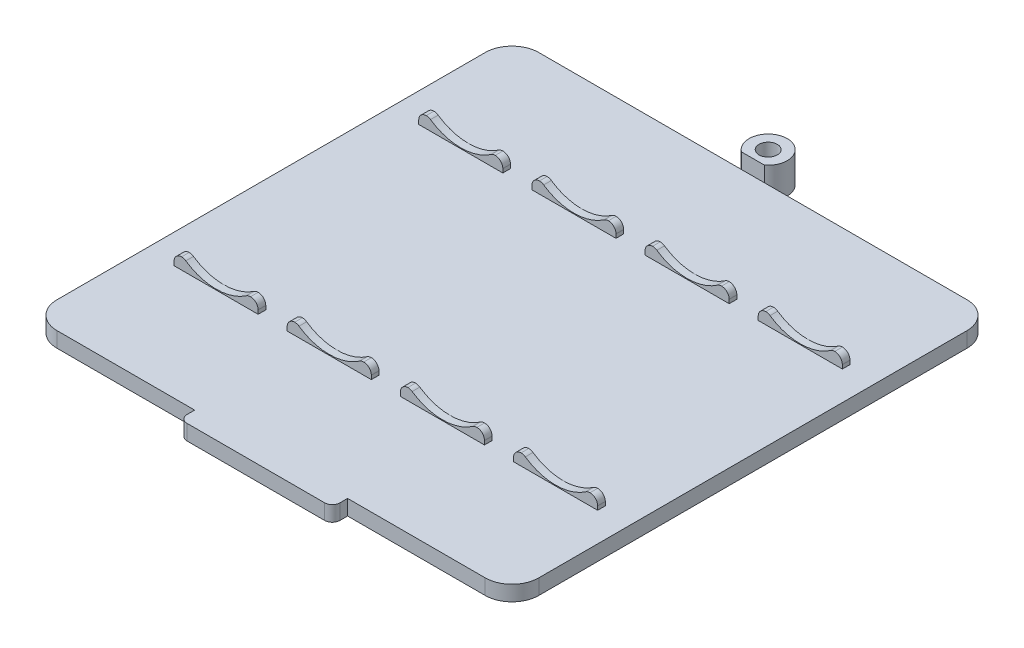
from build123d import *

# Parameters (mm, degrees)
BOSS_EXTRUDE1_DEPTH                     = 2
SKETCH2_R                               = 2.5
BOSS_EXTRUDE3_DEPTH                     = 4
SKETCH5_W                               = 11
SKETCH5_H                               = 1
EXTRUDE_THIN2_DEPTH                     = 1.5
CUT_EXTRUDE2_DEPTH                      = 49.002604096
CUT_EXTRUDE2_DEPTH_BACK                 = 49.002604096
SKETCH7_R                               = 7
FILLET2_R                               = 1
CUT_EXTRUDE3_START                      = -2
CUT_EXTRUDE3_DEPTH                      = 2
CBORE_FOR_M2_HEX_HEAD_BOLT2_D           = 2.4
CBORE_FOR_M2_HEX_HEAD_BOLT2_CBORE_D     = 4.4
CBORE_FOR_M2_HEX_HEAD_BOLT2_CBORE_DEPTH = 1.76


with BuildPart() as part:
    # Sketch1 → Boss-Extrude1 (new body)
    with BuildSketch(Plane(origin=(0, 0, 0), x_dir=(1, 0, 0), z_dir=(0, 1, 0))):
        with BuildLine():
            Line((10, -31.5), (28, -31.5))
            ThreePointArc((28, -31.5), (30.474873734, -30.474873734), (31.5, -28))
            Line((31.5, -28), (31.5, 28))
            ThreePointArc((31.5, 28), (30.474873734, 30.474873734), (28, 31.5))
            Line((28, 31.5), (-28, 31.5))
            ThreePointArc((-28, 31.5), (-30.474873734, 30.474873734), (-31.5, 28))
            Line((-31.5, 28), (-31.5, -28))
            ThreePointArc((-31.5, -28), (-30.474873734, -30.474873734), (-28, -31.5))
            Line((-28, -31.5), (-10, -31.5))
            Line((-10, -31.5), (-10, -32.5))
            ThreePointArc((-10, -32.5), (-9.707106781, -33.207106781), (-9, -33.5))
            Line((-9, -33.5), (9, -33.5))
            ThreePointArc((9, -33.5), (9.707106781, -33.207106781), (10, -32.5))
            Line((10, -32.5), (10, -31.5))
        make_face()
    extrude(amount=BOSS_EXTRUDE1_DEPTH)

    # Sketch2 → Boss-Extrude3 (add)
    with BuildSketch(Plane(origin=(0, 0, 0), x_dir=(1, 0, 0), z_dir=(0, 1, 0))):
        with Locations(Location((0, 33.5, 0), (0, 0, 233.130102354))):
            Circle(SKETCH2_R)
    extrude(amount=BOSS_EXTRUDE3_DEPTH)

    # Sketch5 → Extrude-Thin2 (add)
    with BuildSketch(Plane(origin=(0, 2, 0), x_dir=(1, 0, 0), z_dir=(0, 1, 0))):
        with Locations((-22.2, 16)):
            Rectangle(SKETCH5_W, SKETCH5_H)
        with Locations((-22.2, -16)):
            Rectangle(SKETCH5_W, SKETCH5_H)
        with Locations((-7.4, -16)):
            Rectangle(SKETCH5_W, SKETCH5_H)
        with Locations((-7.4, 16)):
            Rectangle(SKETCH5_W, SKETCH5_H)
        with Locations((7.4, -16)):
            Rectangle(SKETCH5_W, SKETCH5_H)
        with Locations((7.4, 16)):
            Rectangle(SKETCH5_W, SKETCH5_H)
        with Locations((22.2, -16)):
            Rectangle(SKETCH5_W, SKETCH5_H)
        with Locations((22.2, 16)):
            Rectangle(SKETCH5_W, SKETCH5_H)
    extrude(amount=EXTRUDE_THIN2_DEPTH)

    # Sketch7 → Cut-Extrude2 (cut, two sides: drawn at the far end of the back side and taken through both)
    with BuildSketch(Plane.XY.offset(-CUT_EXTRUDE2_DEPTH_BACK)):
        with Locations((-22.2, 9.1)):
            Circle(SKETCH7_R)
        with Locations((-7.4, 9.1)):
            Circle(SKETCH7_R)
        with Locations((7.4, 9.1)):
            Circle(SKETCH7_R)
        with Locations((22.2, 9.1)):
            Circle(SKETCH7_R)
    extrude(amount=CUT_EXTRUDE2_DEPTH + CUT_EXTRUDE2_DEPTH_BACK, mode=Mode.SUBTRACT)

    # Fillet2
    # the kernel refuses this fillet: 1 mm, written as the material it takes off along each edge
    with BuildSketch(Plane(origin=(-16.7, 3.5, 19), x_dir=(0, -1, 0), z_dir=(0, 0, -1)), Plane(origin=(-27.7, 3.5, 13), x_dir=(0, -1, 0), z_dir=(0, 0, 1)), Plane(origin=(-12.9, 3.5, 13), x_dir=(0, -1, 0), z_dir=(0, 0, 1)), Plane(origin=(-1.9, 3.5, 19), x_dir=(0, -1, 0), z_dir=(0, 0, -1)), Plane(origin=(1.9, 3.5, 13), x_dir=(0, -1, 0), z_dir=(0, 0, 1)), Plane(origin=(12.9, 3.5, 19), x_dir=(0, -1, 0), z_dir=(0, 0, -1)), Plane(origin=(16.7, 3.5, 13), x_dir=(0, -1, 0), z_dir=(0, 0, 1)), Plane(origin=(27.7, 3.5, 19), x_dir=(0, -1, 0), z_dir=(0, 0, -1)), Plane(origin=(16.7, 3.5, -19), x_dir=(0, -1, 0), z_dir=(0, 0, 1)), Plane(origin=(27.7, 3.5, -13), x_dir=(0, -1, 0), z_dir=(0, 0, -1)), Plane(origin=(12.9, 3.5, -13), x_dir=(0, -1, 0), z_dir=(0, 0, -1)), Plane(origin=(1.9, 3.5, -19), x_dir=(0, -1, 0), z_dir=(0, 0, 1)), Plane(origin=(-1.9, 3.5, -13), x_dir=(0, -1, 0), z_dir=(0, 0, -1)), Plane(origin=(-12.9, 3.5, -19), x_dir=(0, -1, 0), z_dir=(0, 0, 1)), Plane(origin=(-16.7, 3.5, -13), x_dir=(0, -1, 0), z_dir=(0, 0, -1)), Plane(origin=(-27.7, 3.5, -19), x_dir=(0, -1, 0), z_dir=(0, 0, 1))) as fillet2_piece_1:
        with BuildLine():
            CenterArc((FILLET2_R, FILLET2_R), FILLET2_R, 180, 90)
            Line((0, FILLET2_R), (0, 0))
            Line((0, 0), (FILLET2_R, 0))
        make_face()
    extrude(amount=6, mode=Mode.SUBTRACT)
    with BuildSketch(Plane(origin=(-18, 3.5, 17.302654555), x_dir=(1, 0, 0), z_dir=(0, 0, -1)), Plane(origin=(-3.2, 3.5, 17.302654555), x_dir=(1, 0, 0), z_dir=(0, 0, -1)), Plane(origin=(11.6, 3.5, 17.302654555), x_dir=(1, 0, 0), z_dir=(0, 0, -1)), Plane(origin=(26.4, 3.5, 17.302654555), x_dir=(1, 0, 0), z_dir=(0, 0, -1))) as fillet2_piece_2:
        with BuildLine():
            CenterArc((0.321061822, 1), FILLET2_R, 235.58849133, 34.41150867)
            ThreePointArc((-0.244070906, 0.175), (-0.121096827, 0.088809093), (0, 0))
            Line((0, 0), (0.321061822, 0))
        make_face()
    extrude(amount=2.605309111, mode=Mode.SUBTRACT)
    with BuildSketch(Plane(origin=(-26.4, 3.5, 17.302654555), x_dir=(0.8126870133502501, -0.5827004533479019, 0), z_dir=(0, 0, -1)), Plane(origin=(-11.6, 3.5, 17.302654555), x_dir=(0.8126870133502461, -0.5827004533479074, 0), z_dir=(0, 0, -1)), Plane(origin=(3.2, 3.5, 17.302654555), x_dir=(0.8126870133502461, -0.5827004533479074, 0), z_dir=(0, 0, -1)), Plane(origin=(18, 3.5, 17.302654555), x_dir=(0.8126870133502501, -0.5827004533479019, 0), z_dir=(0, 0, -1))) as fillet2_piece_3:
        with BuildLine():
            CenterArc((0.32177768, 0.999769883), FILLET2_R, 234.359296842, 34.41150867)
            Line((-0.260922773, 0.187082869), (0, 0))
            ThreePointArc((0, 0), (0.150162917, 0.001610821), (0.300325835, 0))
        make_face()
    extrude(amount=2.605309111, mode=Mode.SUBTRACT)
    with BuildSketch(Plane(origin=(18, 3.5, -17.302654555), x_dir=(0.8126870133502501, -0.5827004533479019, 0), z_dir=(0, 0, 1)), Plane(origin=(3.2, 3.5, -17.302654555), x_dir=(0.8126870133502461, -0.5827004533479074, 0), z_dir=(0, 0, 1)), Plane(origin=(-11.6, 3.5, -17.302654555), x_dir=(0.8126870133502461, -0.5827004533479074, 0), z_dir=(0, 0, 1)), Plane(origin=(-26.4, 3.5, -17.302654555), x_dir=(0.8126870133502501, -0.5827004533479019, 0), z_dir=(0, 0, 1))) as fillet2_piece_4:
        with BuildLine():
            CenterArc((0.32177768, -0.999769883), FILLET2_R, 91.229194488, 34.41150867)
            Line((-0.260922773, -0.187082869), (0, 0))
            ThreePointArc((0, 0), (0.150162917, -0.001610821), (0.300325835, 0))
        make_face()
    extrude(amount=2.605309111, mode=Mode.SUBTRACT)
    with BuildSketch(Plane(origin=(26.4, 3.5, -17.302654555), x_dir=(1, 0, 0), z_dir=(0, 0, 1)), Plane(origin=(11.6, 3.5, -17.302654555), x_dir=(1, 0, 0), z_dir=(0, 0, 1)), Plane(origin=(-3.2, 3.5, -17.302654555), x_dir=(1, 0, 0), z_dir=(0, 0, 1)), Plane(origin=(-18, 3.5, -17.302654555), x_dir=(1, 0, 0), z_dir=(0, 0, 1))) as fillet2_piece_5:
        with BuildLine():
            CenterArc((0.321061822, -1), FILLET2_R, 90, 34.41150867)
            ThreePointArc((-0.244070906, -0.175), (-0.121096827, -0.088809093), (0, 0))
            Line((0, 0), (0.321061822, 0))
        make_face()
    extrude(amount=2.605309111, mode=Mode.SUBTRACT)

    # Sketch8 → Cut-Extrude3 (cut)
    with BuildSketch(Plane(origin=(0, 4, 0), x_dir=(1, 0, 0), z_dir=(0, 1, 0)).offset(CUT_EXTRUDE3_START)):
        with BuildLine():
            Line((-1.5, 31.5), (1.5, 31.5))
            ThreePointArc((1.5, 31.5), (0, 31), (-1.5, 31.5))
        make_face()
    extrude(amount=CUT_EXTRUDE3_DEPTH, mode=Mode.SUBTRACT)

    # CBORE for M2 Hex Head Bolt2 (through all)
    with Locations(Plane(origin=(0, 0, 0), x_dir=(-1, 0, 0), z_dir=(0, -1, 0))):
        with Locations((0, 33.5)):
            CounterBoreHole(CBORE_FOR_M2_HEX_HEAD_BOLT2_D / 2, CBORE_FOR_M2_HEX_HEAD_BOLT2_CBORE_D / 2, CBORE_FOR_M2_HEX_HEAD_BOLT2_CBORE_DEPTH)


solid = part.part
